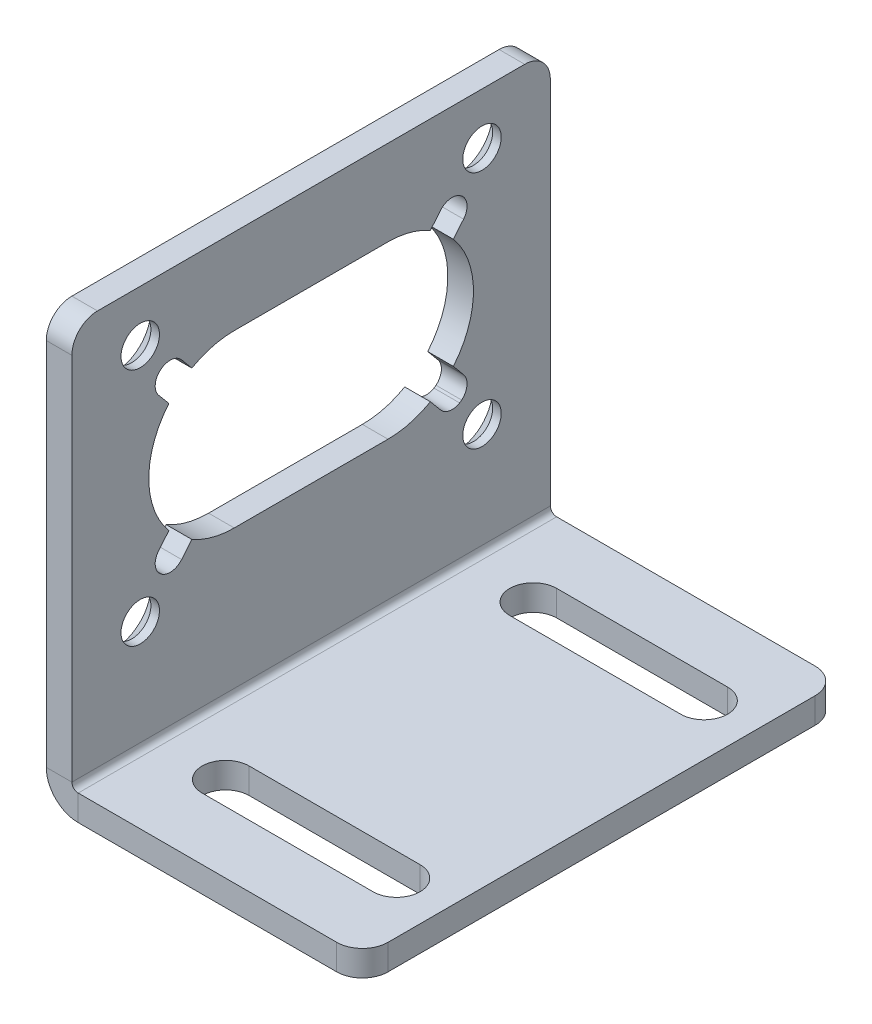
from build123d import *

# Parameters (mm, degrees)
BASE_FLANGE1_DEPTH           = 3
EDGE_FLANGE1_STRIP_W         = 13.4732
EDGE_FLANGE1_STRIP_H         = 3
EDGE_FLANGE1_STRIP_CUT_DEPTH = 56
EDGE_FLANGE1_DEPTH           = 56
EDGE_FLANGE1_FLAT_DEPTH      = 3
SKETCH5_R                    = 2.25
CUT_EXTRUDE1_DEPTH           = 3
CHAMFER1_SIZE                = 2


# Sheet-metal steps are written as plain solids
with BuildPart() as part:
    # Sketch1 → Base-Flange1 (new body)
    with BuildSketch(Plane(origin=(0, 0, 0), x_dir=(1, 0, 0), z_dir=(0, 1, 0))):
        with BuildLine():
            Line((-18.5, 28), (15.5, 28))
            ThreePointArc((15.5, 28), (17.621320344, 27.121320344), (18.5, 25))
            Line((18.5, 25), (18.5, -25))
            ThreePointArc((18.5, -25), (17.621320344, -27.121320344), (15.5, -28))
            Line((15.5, -28), (-18.5, -28))
            Line((-18.5, -28), (-18.5, 28))
        make_face()
        with BuildLine():
            Line((-7.5, -15.25), (12.5, -15.25))
            ThreePointArc((12.5, -15.25), (15.25, -18), (12.5, -20.75))
            Line((12.5, -20.75), (-7.5, -20.75))
            ThreePointArc((-7.5, -20.75), (-10.25, -18), (-7.5, -15.25))
        make_face(mode=Mode.SUBTRACT)
        with BuildLine():
            Line((-7.5, 15.25), (12.5, 15.25))
            ThreePointArc((12.5, 15.25), (15.25, 18), (12.5, 20.75))
            Line((12.5, 20.75), (-7.5, 20.75))
            ThreePointArc((-7.5, 20.75), (-10.25, 18), (-7.5, 15.25))
        make_face(mode=Mode.SUBTRACT)
    extrude(amount=-BASE_FLANGE1_DEPTH)

    # Edge-Flange1 strip (across the edge) → Edge-Flange1 strip cut (cut)
    with BuildSketch(Plane(origin=(-18.5, 0, -28), x_dir=(1, 0, 0), z_dir=(0, 0, 1))):
        with Locations((-3, -1.5)):
            Rectangle(EDGE_FLANGE1_STRIP_W, EDGE_FLANGE1_STRIP_H)
    extrude(amount=EDGE_FLANGE1_STRIP_CUT_DEPTH, mode=Mode.SUBTRACT)

    # Edge-Flange1 bend section (across the edge) → Edge-Flange1 (add)
    with BuildSketch(Plane(origin=(-18.5, 0, -28), x_dir=(1, 0, 0), z_dir=(0, 0, 1))):
        with BuildLine():
            Line((0, 0.7366), (3, 0.7366))
            ThreePointArc((3, 0.7366), (3.215745145, 0.215745145), (3.7366, 0))
            Line((3.7366, 0), (3.7366, -3))
            ThreePointArc((3.7366, -3), (1.094424801, -1.905575199), (0, 0.7366))
        make_face()
    extrude(amount=EDGE_FLANGE1_DEPTH)

    # Edge-Flange1 profile (on flange) → Edge-Flange1 flat (add)
    with BuildSketch(Plane(origin=(-18.5, 0, 0), x_dir=(0, 0, -1), z_dir=(1, 0, 0))):
        with BuildLine():
            Line((-28, 0.7366), (28, 0.7366))
            Line((28, 0.7366), (28, 44))
            ThreePointArc((28, 44), (27.121320344, 46.121320344), (25, 47))
            Line((25, 47), (-25, 47))
            ThreePointArc((-25, 47), (-27.121320344, 46.121320344), (-28, 44))
            Line((-28, 44), (-28, 0.7366))
        make_face()
    extrude(amount=EDGE_FLANGE1_FLAT_DEPTH)

    # Sketch5 → Cut-Extrude1 (cut)
    with BuildSketch(Plane.ZY.offset(18.5)):
        with BuildLine():
            Line((9, 37), (-9, 37))
            ThreePointArc((-9, 37), (-11.565163819, 36.665398832), (-13.958666275, 35.683986917))
            Line((-13.958666275, 35.683986917), (-15.155612761, 37.120322699))
            ThreePointArc((-15.155612761, 37.120322699), (-16.195875666, 37.723371228), (-17.379716482, 37.512811591))
            ThreePointArc((-17.379716482, 37.512811591), (-17.498601644, 37.426573777), (-17.620322699, 37.344387239))
            ThreePointArc((-17.620322699, 37.344387239), (-18.242813111, 36.158437556), (-17.844387239, 34.879677301))
            Line((-17.844387239, 34.879677301), (-16.647440754, 33.443341518))
            ThreePointArc((-16.647440754, 33.443341518), (-19, 27), (-16.647440754, 20.556658482))
            Line((-16.647440754, 20.556658482), (-17.844387239, 19.120322699))
            ThreePointArc((-17.844387239, 19.120322699), (-18.242813111, 17.841562444), (-17.620322699, 16.655612761))
            ThreePointArc((-17.620322699, 16.655612761), (-17.498601644, 16.573426223), (-17.379716482, 16.487188409))
            ThreePointArc((-17.379716482, 16.487188409), (-16.195875666, 16.276628772), (-15.155612761, 16.879677301))
            Line((-15.155612761, 16.879677301), (-13.958666275, 18.316013083))
            ThreePointArc((-13.958666275, 18.316013083), (-11.565163819, 17.334601168), (-9, 17))
            Line((-9, 17), (9, 17))
            ThreePointArc((9, 17), (11.565163819, 17.334601168), (13.958666275, 18.316013083))
            Line((13.958666275, 18.316013083), (15.155612761, 16.879677301))
            ThreePointArc((15.155612761, 16.879677301), (16.195875666, 16.276628772), (17.379716482, 16.487188409))
            ThreePointArc((17.379716482, 16.487188409), (17.498601644, 16.573426223), (17.620322699, 16.655612761))
            ThreePointArc((17.620322699, 16.655612761), (18.242813111, 17.841562444), (17.844387239, 19.120322699))
            Line((17.844387239, 19.120322699), (16.647440754, 20.556658482))
            ThreePointArc((16.647440754, 20.556658482), (19, 27), (16.647440754, 33.443341518))
            Line((16.647440754, 33.443341518), (17.844387239, 34.879677301))
            ThreePointArc((17.844387239, 34.879677301), (18.242813111, 36.158437556), (17.620322699, 37.344387239))
            ThreePointArc((17.620322699, 37.344387239), (17.498601644, 37.426573777), (17.379716482, 37.512811591))
            ThreePointArc((17.379716482, 37.512811591), (16.195875666, 37.723371228), (15.155612761, 37.120322699))
            Line((15.155612761, 37.120322699), (13.958666275, 35.683986917))
            ThreePointArc((13.958666275, 35.683986917), (11.565163819, 36.665398832), (9, 37))
        make_face()
        with Locations(Location((20, 41, 0), (0, 0, 270))):
            Circle(SKETCH5_R)
        with Locations(Location((-20, 41, 0), (0, 0, 270))):
            Circle(SKETCH5_R)
        with Locations(Location((-20, 13, 0), (0, 0, 270))):
            Circle(SKETCH5_R)
        with Locations(Location((20, 13, 0), (0, 0, 270))):
            Circle(SKETCH5_R)
    extrude(amount=-CUT_EXTRUDE1_DEPTH, mode=Mode.SUBTRACT)

    # Chamfer1
    chamfer1_edges = [part.edges().sort_by_distance(p)[0] for p in [
        (-18.5, 15.25, -20),
        (-18.5, 15.25, 20),
        (-18.5, 43.25, 20),
        (-18.5, 43.25, -20),
    ]]
    chamfer(chamfer1_edges, length=CHAMFER1_SIZE)


solid = part.part
